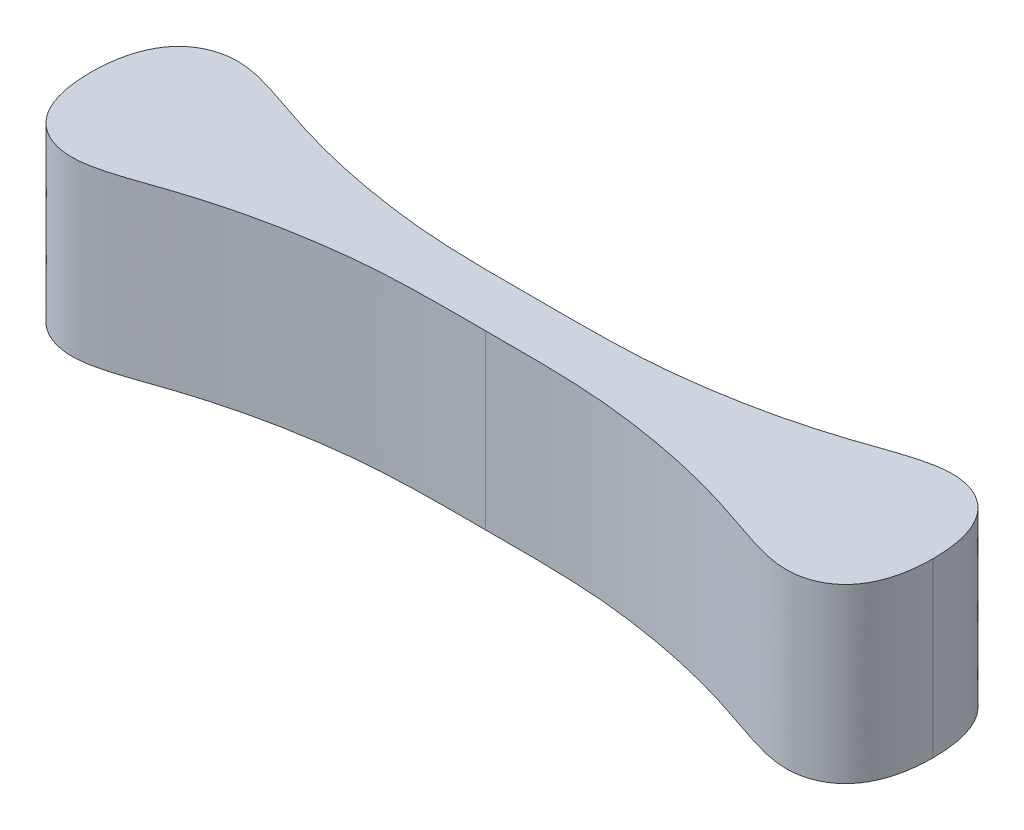
from build123d import *

# Parameters (mm, degrees)
BOSS_EXTRUDE1_DEPTH = 26


with BuildPart() as part:
    # Sketch2 → Boss-Extrude1 (new body)
    with BuildSketch(Plane(origin=(0, 0, 0), x_dir=(1, 0, 0), z_dir=(0, 1, 0))):
        with BuildLine():
            add(Edge.make_bspline(
                [(-63.5, 0), (-63.5, 8.613753202), (-58.666602813, 12.401756197), (-50.868328769, 12.631090146), (-39.982788641, 8.367967953), (-28.80898836, 5.728660359), (-14.344190031, 3.897193564), (-5.929716088, 4), (0, 4)],
                knots=[0, 0, 0, 0, 0.199843992, 0.238288941, 0.384449492, 0.645137589, 0.74628204, 1, 1, 1, 1], degree=3))
            add(Edge.make_bspline(
                [(63.5, 0), (63.5, 8.613753202), (58.666602813, 12.401756197), (50.868328769, 12.631090146), (39.982788641, 8.367967953), (28.80898836, 5.728660359), (14.344190031, 3.897193564), (5.929716088, 4), (0, 4)],
                knots=[0, 0, 0, 0, 0.199843992, 0.238288941, 0.384449492, 0.645137589, 0.74628204, 1, 1, 1, 1], degree=3))
            add(Edge.make_bspline(
                [(63.5, 0), (63.5, -8.613753202), (58.666602813, -12.401756197), (50.868328769, -12.631090146), (39.982788641, -8.367967953), (28.80898836, -5.728660359), (14.344190031, -3.897193564), (5.929716088, -4), (0, -4)],
                knots=[0, 0, 0, 0, 0.199843992, 0.238288941, 0.384449492, 0.645137589, 0.74628204, 1, 1, 1, 1], degree=3))
            add(Edge.make_bspline(
                [(-63.5, 0), (-63.5, -8.613753202), (-58.666602813, -12.401756197), (-50.868328769, -12.631090146), (-39.982788641, -8.367967953), (-28.80898836, -5.728660359), (-14.344190031, -3.897193564), (-5.929716088, -4), (0, -4)],
                knots=[0, 0, 0, 0, 0.199843992, 0.238288941, 0.384449492, 0.645137589, 0.74628204, 1, 1, 1, 1], degree=3))
        make_face()
    extrude(amount=BOSS_EXTRUDE1_DEPTH)


solid = part.part
